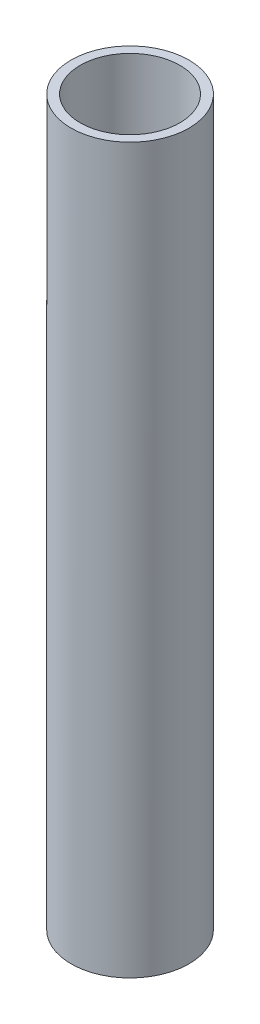
from build123d import *

# Parameters (mm, degrees)
SKETCH1_R           = 5.5
SKETCH1_R_2         = 2.75
BOSS_EXTRUDE1_DEPTH = 16
BOSS_EXTRUDE2_START = 1.5
SKETCH2_R           = 5.5
SKETCH2_R_2         = 1
BOSS_EXTRUDE2_DEPTH = 1.5
SKETCH3_R           = 5.5
SKETCH3_R_2         = 4.65
BOSS_EXTRUDE3_DEPTH = 50
CHAMFER1_SIZE       = 2
FILLET1_R           = 1


with BuildPart() as part:
    # Sketch1 → Boss-Extrude1 (new body)
    with BuildSketch(Plane(origin=(0, 0, 0), x_dir=(1, 0, 0), z_dir=(0, 1, 0))):
        with Locations(Location((0, 0, 0), (0, 0, 270))):
            Circle(SKETCH1_R)
        with Locations(Location((0, 0, 0), (0, 0, 270))):
            Circle(SKETCH1_R_2, mode=Mode.SUBTRACT)
    extrude(amount=BOSS_EXTRUDE1_DEPTH)

    # Sketch2 → Boss-Extrude2 (add)
    with BuildSketch(Plane.XZ.offset(BOSS_EXTRUDE2_START)):
        with Locations(Location((0, 0, 0), (0, 0, 270))):
            Circle(SKETCH2_R)
        with Locations(Location((0, 0, 0), (0, 0, 270))):
            Circle(SKETCH2_R_2, mode=Mode.SUBTRACT)
    extrude(amount=-BOSS_EXTRUDE2_DEPTH)

    # Sketch3 → Boss-Extrude3 (add)
    with BuildSketch(Plane(origin=(0, 16, 0), x_dir=(1, 0, 0), z_dir=(0, 1, 0))):
        with Locations(Location((0, 0, 0), (0, 0, 90))):
            Circle(SKETCH3_R)
        with Locations(Location((0, 0, 0), (0, 0, 270))):
            Circle(SKETCH3_R_2, mode=Mode.SUBTRACT)
    extrude(amount=BOSS_EXTRUDE3_DEPTH)

    # Chamfer1
    # the kernel refuses this chamfer: 2 mm, written as the material it adds along each edge
    with BuildSketch(Plane(origin=(0, 0, 0), x_dir=(0, 0, 1), z_dir=(-1, 0, 0))) as chamfer1_piece_1_section:
        Polygon((2.75 - CHAMFER1_SIZE, 0), (2.75, CHAMFER1_SIZE), (2.75, 0), align=None)
    chamfer1_piece_1 = revolve(axis=Axis((0, 0, 0), (0, 1, 0)), mode=Mode.PRIVATE)
    chamfer1_piece_1 = chamfer1_piece_1 - Plane(origin=(0, 1.131660662, 0), x_dir=(0, 0, -1), z_dir=(0, -1, 0)) * Cylinder(1, 11, mode=Mode.PRIVATE)
    add(chamfer1_piece_1)

    # Fillet1
    fillet1_edges = [part.edges().sort_by_distance(p)[0] for p in [
        (0, 16, -2.75),
    ]]
    fillet(fillet1_edges, radius=FILLET1_R)


solid = part.part
